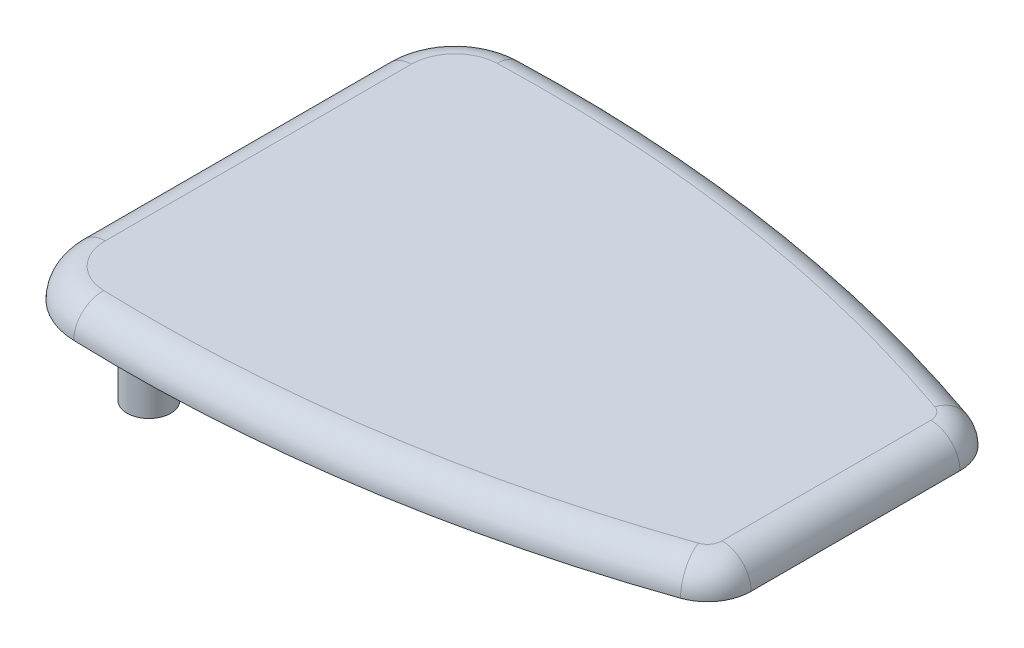
from build123d import *

# Parameters (mm, degrees)
BOSS_EXTRUDE1_DEPTH = 1
SKETCH2_R           = 2.5
SKETCH2_R_2         = 1.5
BOSS_EXTRUDE2_DEPTH = 1
SKETCH2_2_R         = 1.5
BOSS_EXTRUDE3_DEPTH = 6
FILLET1_R           = 2


with BuildPart() as part:
    # Sketch1 → Boss-Extrude1 (new, symmetric)
    with BuildSketch(Plane(origin=(0, 0, 0), x_dir=(1, 0, 0), z_dir=(0, 1, 0))):
        with BuildLine():
            Line((0, -7.166621556), (0, 7.166621556))
            ThreePointArc((0, 7.166621556), (-0.554836306, 8.90477417), (-2.01411634, 10))
            ThreePointArc((-2.01411634, 10), (-19.83571516, 14.416393561), (-38.164373421, 15.5))
            ThreePointArc((-38.164373421, 15.5), (-41.593178753, 13.979636076), (-43, 10.502702593))
            Line((-43, 10.502702593), (-43, -10.502702593))
            ThreePointArc((-43, -10.502702593), (-41.593178753, -13.979636076), (-38.164373421, -15.5))
            ThreePointArc((-38.164373421, -15.5), (-19.83571516, -14.416393561), (-2.01411634, -10))
            ThreePointArc((-2.01411634, -10), (-0.554836306, -8.90477417), (0, -7.166621556))
        make_face()
    extrude(amount=BOSS_EXTRUDE1_DEPTH, both=True)

    # Sketch2 → Boss-Extrude2 (add)
    with BuildSketch(Plane.XZ.offset(1)):
        with Locations(Location((-8, 0, 0), (0, 0, 270))):
            Circle(SKETCH2_R)
        with Locations(Location((-8, 0, 0), (0, 0, 270))):
            Circle(SKETCH2_R_2, mode=Mode.SUBTRACT)
    boss_extrude2 = extrude(amount=BOSS_EXTRUDE2_DEPTH)

    # Sketch2<2> → Boss-Extrude3 (add)
    with BuildSketch(Plane.XZ.offset(1)):
        with Locations(Location((-8, 0, 0), (0, 0, 270))):
            Circle(SKETCH2_2_R)
    boss_extrude3 = extrude(amount=BOSS_EXTRUDE3_DEPTH)

    # Sketch-Pattern1: Boss-Extrude2, Boss-Extrude3 at 2 more places
    with Locations((-30, 0, 10.502703), (-30, 0, -10.502703)):
        add(boss_extrude2)
        add(boss_extrude3)

    # Fillet1
    fillet1_edges = [part.edges().sort_by_distance(p)[0] for p in [
        (-19.83571516, 1, 14.416393561),
        (-41.593178753, 1, 13.979636076),
        (-43, 1, 0),
        (-41.593178753, 1, -13.979636076),
        (-0.554836306, 1, -8.90477417),
        (0, 1, 0),
        (-0.554836306, 1, 8.90477417),
        (-19.83571516, 1, -14.416393561),
    ]]
    fillet(fillet1_edges, radius=FILLET1_R - 0.0001)  # a hair under: the kernel refuses the full size


solid = part.part
